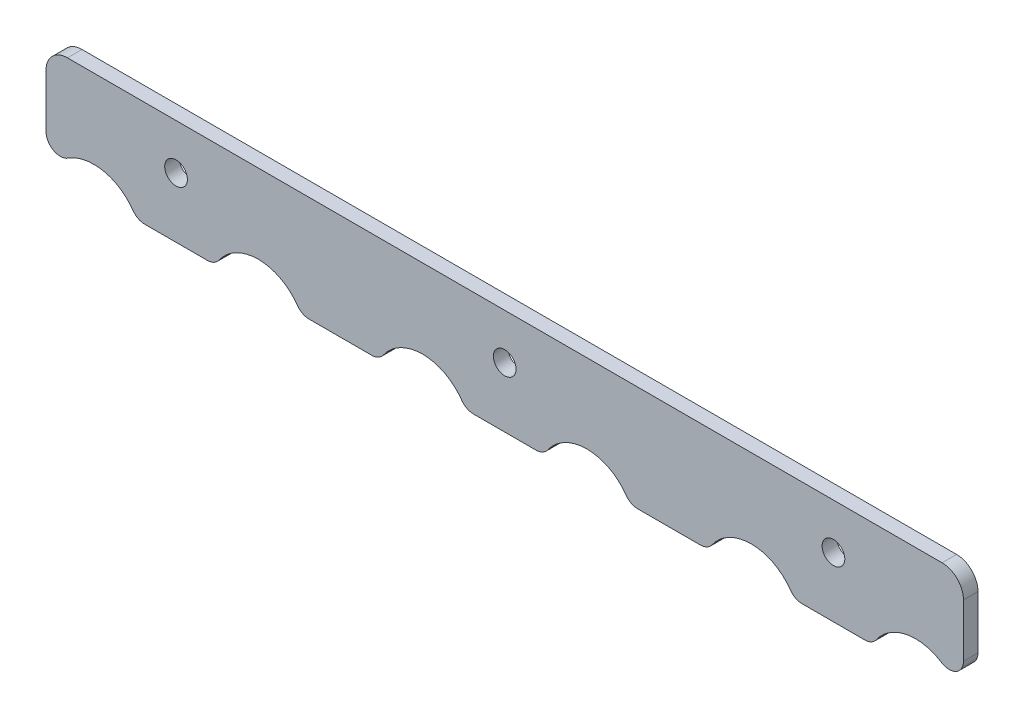
from build123d import *

# Parameters (mm, degrees)
BOSS_EXTRUDE1_DEPTH = 2.032
FILLET1_R           = 3
FILLET2_R           = 2
SKETCH4_R           = 1.5875
CUT_EXTRUDE1_DEPTH  = 136.528598113


with BuildPart() as part:
    # Sketch3 → Boss-Extrude1 (new body)
    with BuildSketch(Plane.XY):
        with BuildLine():
            ThreePointArc((4.075, 10.775), (9.233659082, 17.295296632), (16.76582632, 13.775))
            Line((16.76582632, 13.775), (27.78417368, 13.775))
            ThreePointArc((27.78417368, 13.775), (33.775, 17.475), (39.76582632, 13.775))
            Line((39.76582632, 13.775), (50.78417368, 13.775))
            ThreePointArc((50.78417368, 13.775), (56.775, 17.475), (62.76582632, 13.775))
            Line((62.76582632, 13.775), (73.78417368, 13.775))
            ThreePointArc((73.78417368, 13.775), (79.775, 17.475), (85.76582632, 13.775))
            Line((85.76582632, 13.775), (96.78417368, 13.775))
            ThreePointArc((96.78417368, 13.775), (102.775, 17.475), (108.76582632, 13.775))
            Line((108.76582632, 13.775), (119.78417368, 13.775))
            ThreePointArc((119.78417368, 13.775), (127.316340918, 17.295296632), (132.475, 10.775))
            Line((132.475, 10.775), (132.475, 28.535))
            Line((132.475, 28.535), (4.075, 28.535))
            Line((4.075, 28.535), (4.075, 10.775))
        make_face()
    extrude(amount=BOSS_EXTRUDE1_DEPTH)

    # Fillet1
    fillet1_edges = [part.edges().sort_by_distance(p)[0] for p in [
        (4.075, 28.535, 1.016),
        (132.475, 28.535, 1.016),
    ]]
    fillet(fillet1_edges, radius=FILLET1_R)

    # Fillet2
    fillet2_edges = [part.edges().sort_by_distance(p)[0] for p in [
        (119.78417368, 13.775, 1.016),
    ]]
    fillet(fillet2_edges, radius=FILLET2_R)
    fillet2_2_edges = [part.edges().sort_by_distance(p)[0] for p in [
        (108.76582632, 13.775, 1.016),
    ]]
    fillet(fillet2_2_edges, radius=FILLET2_R)
    fillet2_3_edges = [part.edges().sort_by_distance(p)[0] for p in [
        (96.78417368, 13.775, 1.016),
    ]]
    fillet(fillet2_3_edges, radius=FILLET2_R)
    fillet2_4_edges = [part.edges().sort_by_distance(p)[0] for p in [
        (4.075, 10.775, 1.016),
    ]]
    fillet(fillet2_4_edges, radius=FILLET2_R)
    fillet2_5_edges = [part.edges().sort_by_distance(p)[0] for p in [
        (85.76582632, 13.775, 1.016),
    ]]
    fillet(fillet2_5_edges, radius=FILLET2_R)
    fillet2_6_edges = [part.edges().sort_by_distance(p)[0] for p in [
        (16.76582632, 13.775, 1.016),
    ]]
    fillet(fillet2_6_edges, radius=FILLET2_R)
    fillet2_7_edges = [part.edges().sort_by_distance(p)[0] for p in [
        (73.78417368, 13.775, 1.016),
    ]]
    fillet(fillet2_7_edges, radius=FILLET2_R)
    fillet2_8_edges = [part.edges().sort_by_distance(p)[0] for p in [
        (27.78417368, 13.775, 1.016),
    ]]
    fillet(fillet2_8_edges, radius=FILLET2_R)
    fillet2_9_edges = [part.edges().sort_by_distance(p)[0] for p in [
        (62.76582632, 13.775, 1.016),
    ]]
    fillet(fillet2_9_edges, radius=FILLET2_R)
    fillet2_10_edges = [part.edges().sort_by_distance(p)[0] for p in [
        (39.76582632, 13.775, 1.016),
    ]]
    fillet(fillet2_10_edges, radius=FILLET2_R)
    fillet2_11_edges = [part.edges().sort_by_distance(p)[0] for p in [
        (50.78417368, 13.775, 1.016),
    ]]
    fillet(fillet2_11_edges, radius=FILLET2_R)
    fillet2_12_edges = [part.edges().sort_by_distance(p)[0] for p in [
        (132.475, 10.775, 1.016),
    ]]
    fillet(fillet2_12_edges, radius=FILLET2_R)

    # Sketch4 → Cut-Extrude1 (cut, through all)
    with BuildSketch(Plane(origin=(0, 0, 0), x_dir=(-1, 0, 0), z_dir=(0, 0, -1))):
        with Locations((-22.275, 22.185)):
            Circle(SKETCH4_R)
        with Locations((-68.275, 22.185)):
            Circle(SKETCH4_R)
        with Locations((-114.275, 22.185)):
            Circle(SKETCH4_R)
    extrude(amount=-CUT_EXTRUDE1_DEPTH, mode=Mode.SUBTRACT)


solid = part.part
